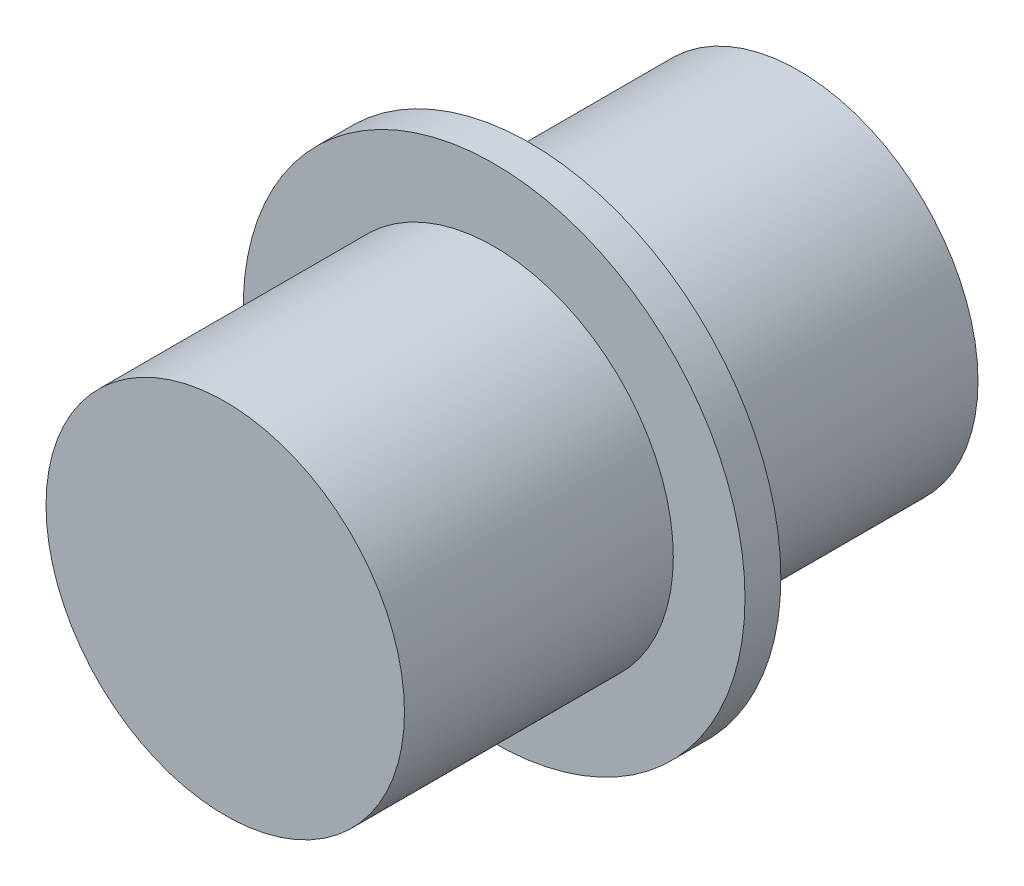
from build123d import *

# Parameters (mm, degrees)
SKETCH1_R           = 10
BOSS_EXTRUDE1_DEPTH = 15
SKETCH2_R           = 14
BOSS_EXTRUDE2_DEPTH = 2
SKETCH3_R           = 10
BOSS_EXTRUDE4_DEPTH = 15


with BuildPart() as part:
    # Sketch1 → Boss-Extrude1 (new body)
    with BuildSketch(Plane.XY):
        Circle(SKETCH1_R)
    extrude(amount=BOSS_EXTRUDE1_DEPTH)

    # Sketch2 → Boss-Extrude2 (add)
    with BuildSketch(Plane.XY.offset(15)):
        Circle(SKETCH2_R)
    extrude(amount=BOSS_EXTRUDE2_DEPTH)

    # Sketch3 → Boss-Extrude4 (add)
    with BuildSketch(Plane.XY.offset(17)):
        Circle(SKETCH3_R)
    extrude(amount=BOSS_EXTRUDE4_DEPTH)


solid = part.part
